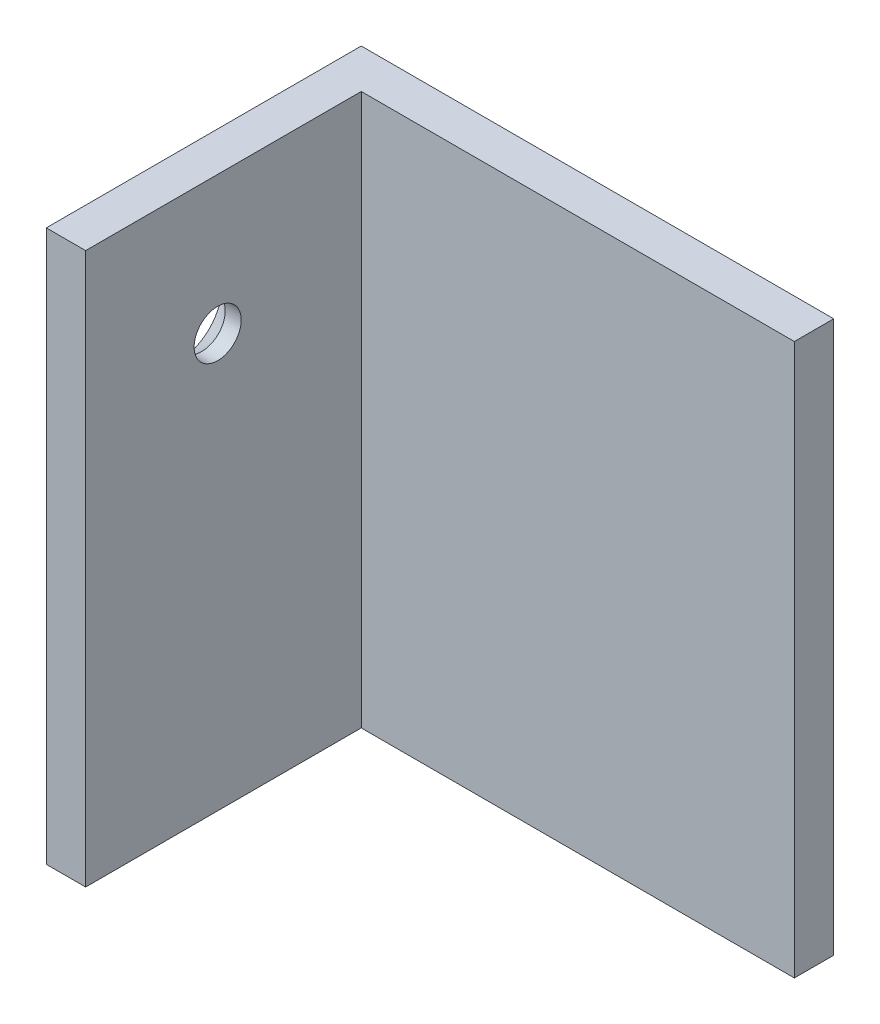
from build123d import *

# Parameters (mm, degrees)
BOSS_EXTRUDE1_DEPTH                            = 22.225
CSK_FOR_6_FLAT_HEAD_MACHINE_SCREW1_D           = 3.7973
CSK_FOR_6_FLAT_HEAD_MACHINE_SCREW1_CSINK_D     = 7.0866
CSK_FOR_6_FLAT_HEAD_MACHINE_SCREW1_CSINK_ANGLE = 82


with BuildPart() as part:
    # Sketch1 → Boss-Extrude1 (new, symmetric)
    with BuildSketch(Plane(origin=(0, 0, 0), x_dir=(1, 0, 0), z_dir=(0, 1, 0))):
        Polygon((-19.05, -12.7), (-15.875, -12.7), (-15.875, 9.525), (19.05, 9.525), (19.05, 12.7), (-19.05, 12.7), align=None)
    extrude(amount=BOSS_EXTRUDE1_DEPTH, both=True)

    # CSK for #6 Flat Head Machine Screw1 (through all)
    with Locations(Plane.ZY.offset(19.05)):
        with Locations((2.055, 11.1125)):
            CounterSinkHole(CSK_FOR_6_FLAT_HEAD_MACHINE_SCREW1_D / 2, CSK_FOR_6_FLAT_HEAD_MACHINE_SCREW1_CSINK_D / 2, counter_sink_angle=CSK_FOR_6_FLAT_HEAD_MACHINE_SCREW1_CSINK_ANGLE)


solid = part.part
